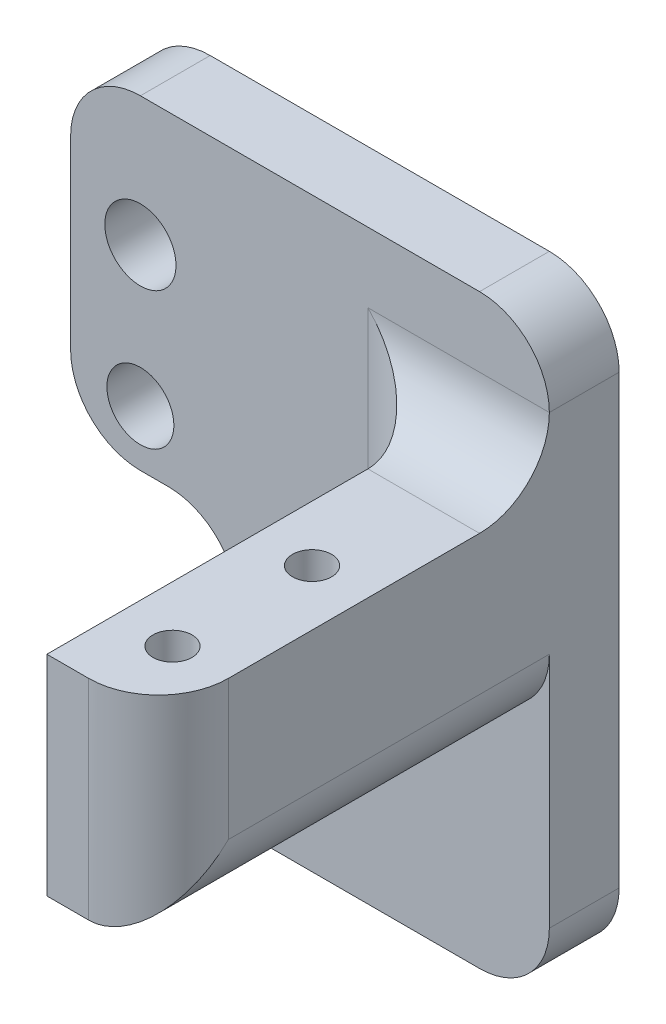
from build123d import *
from OCP.BRepFilletAPI import BRepFilletAPI_MakeFillet

# Parameters (mm, degrees)
SKETCH1_W           = 8
SKETCH1_H           = 15
BOSS_EXTRUDE1_DEPTH = 22
CUT_EXTRUDE1_START  = 18.5
SKETCH2_R           = 1.4
CUT_EXTRUDE1_DEPTH  = 10
SKETCH3_W           = 8
SKETCH3_H           = 15
BOSS_EXTRUDE2_DEPTH = 6
BOSS_EXTRUDE3_START = -6
BOSS_EXTRUDE3_DEPTH = 5
BOSS_EXTRUDE4_START = -11
SKETCH5_W           = 34.3
SKETCH5_H           = 15
BOSS_EXTRUDE4_DEPTH = 5
SKETCH7_R           = 2.55
SKETCH7_R_2         = 2.4
CUT_EXTRUDE2_DEPTH  = 48.05677422
FILLET1_R           = 5
FILLET1_R_2         = 2


with BuildPart() as part:
    # Sketch1 → Boss-Extrude1 (new body)
    with BuildSketch(Plane.XY):
        with Locations((0, 11)):
            Rectangle(SKETCH1_W, SKETCH1_H)
    extrude(amount=BOSS_EXTRUDE1_DEPTH)

    # Sketch2 → Cut-Extrude1 (cut)
    with BuildSketch(Plane(origin=(0, 0, 0), x_dir=(1, 0, 0), z_dir=(0, 1, 0)).offset(CUT_EXTRUDE1_START)):
        with Locations(Location((0, -7, 0), (0, 0, 90))):
            Circle(SKETCH2_R)
        with Locations(Location((0, -17, 0), (0, 0, 90))):
            Circle(SKETCH2_R)
    extrude(amount=-CUT_EXTRUDE1_DEPTH, mode=Mode.SUBTRACT)

    # Sketch3 → Boss-Extrude2 (add)
    with BuildSketch(Plane.XY):
        with Locations((0, 11)):
            Rectangle(SKETCH3_W, SKETCH3_H)
    extrude(amount=-BOSS_EXTRUDE2_DEPTH)

    # Sketch4 → Boss-Extrude3 (add)
    with BuildSketch(Plane.XY.offset(BOSS_EXTRUDE3_START)):
        Polygon((-16, -13.5), (4, -13.5), (4, 13.5), (-30.3, 13.5), (-30.3, 5.25), (-18.3, 5.25), (-18.3, -6.75), (-30.3, -6.75), (-30.3, -13.5), align=None)
    extrude(amount=-BOSS_EXTRUDE3_DEPTH)

    # Sketch5 → Boss-Extrude4 (add)
    with BuildSketch(Plane.XY.offset(BOSS_EXTRUDE4_START)):
        with Locations((-13.15, 21)):
            Rectangle(SKETCH5_W, SKETCH5_H)
    extrude(amount=BOSS_EXTRUDE4_DEPTH)

    # Sketch7 → Cut-Extrude2 (cut, through all)
    with BuildSketch(Plane.XY):
        with Locations((-25.3, 19.25)):
            Circle(SKETCH7_R)
        with Locations((-25.3, 9.25)):
            Circle(SKETCH7_R_2)
    extrude(amount=-CUT_EXTRUDE2_DEPTH, mode=Mode.SUBTRACT)

    # Fillet1
    fillet1_edges_1 = [part.edges().sort_by_distance(p)[0] for p in [
        (-4, 11, -6),
        (0, 18.5, -6),
        (-18.3, -6.75, -8.5),
        (-18.3, 5.25, -8.5),
        (-30.3, 5.25, -8.5),
        (4, -13.5, -8.5),
        (4, 11, 22),
        (4, 28.5, -8.5),
        (-30.3, 28.5, -8.5),
        (4, 3.5, 8),
    ]]
    fillet1_edges_2 = [part.edges().sort_by_distance(p)[0] for p in [
        (-30.3, -6.75, -8.5),
        (-30.3, -13.5, -8.5),
    ]]
    fillet1 = BRepFilletAPI_MakeFillet(part.part.solid().wrapped)
    for e in fillet1_edges_1:
        fillet1.Add(FILLET1_R - 0.0001, e.wrapped)
    for e in fillet1_edges_2:
        fillet1.Add(FILLET1_R_2 - 0.0001, e.wrapped)
    add(Compound.cast(fillet1.Shape()), mode=Mode.REPLACE)  # a hair under: the kernel refuses the full size


solid = part.part
